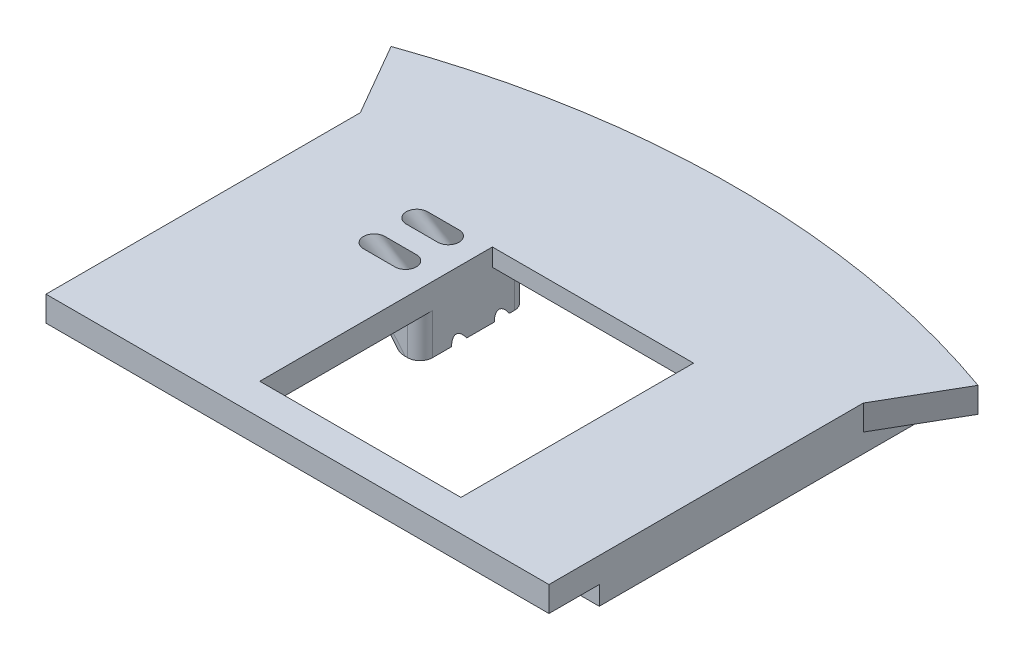
from build123d import *

# Parameters (mm, degrees)
BOSS_EXTRUDE1_DEPTH = 4
CUT_EXTRUDE1_REACH  = 149.251
SKETCH2_W           = 32
SKETCH2_H           = 37
SKETCH3_W           = 32
SKETCH3_H           = 44
CUT_EXTRUDE2_DEPTH  = 1.2
BOSS_EXTRUDE2_DEPTH = 3
CUT_EXTRUDE3_REACH  = 149.251
SKETCH5_W           = 80
SKETCH5_H           = 2
SKETCH13_W          = 10
SKETCH13_H          = 17
BOSS_EXTRUDE3_DEPTH = 6.5
LPATTERN1_COUNT     = 2
LPATTERN1_PITCH     = 6.8
CHAMFER1_SIZE       = 6
CHAMFER1_SIZE2      = 5.034597787
FILLET1_R           = 2


with BuildPart() as part:
    # Sketch1 → Boss-Extrude1 (new body)
    with BuildSketch(Plane(origin=(0, 0, 0), x_dir=(1, 0, 0), z_dir=(0, 1, 0))):
        with BuildLine():
            Line((-40, 68), (-40, 120))
            Line((-40, 120), (-46.677171015, 131.565199449))
            ThreePointArc((-46.677171015, 131.565199449), (0, 139.6), (46.677171015, 131.565199449))
            Line((46.677171015, 131.565199449), (40, 120))
            Line((40, 120), (40, 68))
            Line((40, 68), (-40, 68))
        make_face()
    extrude(amount=BOSS_EXTRUDE1_DEPTH)

    # Sketch2 → Cut-Extrude1 (cut, up to next)
    with BuildSketch(Plane(origin=(0, 4, 0), x_dir=(1, 0, 0), z_dir=(0, 1, 0)), mode=Mode.PRIVATE) as cut_extrude1_sk1:
        with Locations((5, 93.5)):
            Rectangle(SKETCH2_W, SKETCH2_H)
    cut_extrude1_tool1 = extrude(cut_extrude1_sk1.sketch, amount=-CUT_EXTRUDE1_REACH, mode=Mode.PRIVATE) & part.part
    add(cut_extrude1_tool1.solids().sort_by_distance((5, 4, -93.5))[0], mode=Mode.SUBTRACT)

    # Sketch3 → Cut-Extrude2 (cut)
    with BuildSketch(Plane.XZ):
        with Locations((5, -93.5)):
            Rectangle(SKETCH3_W, SKETCH3_H)
    extrude(amount=-CUT_EXTRUDE2_DEPTH, mode=Mode.SUBTRACT)

    # Sketch4 → Boss-Extrude2 (add)
    with BuildSketch(Plane.XZ):
        with BuildLine():
            Line((-40, -78), (-40, -130.236102159))
            ThreePointArc((-40, -130.236102159), (0, -136.240384268), (40, -130.236102159))
            Line((40, -130.236102159), (40, -78))
            Line((40, -78), (37, -78))
            Line((37, -78), (37, -128))
            ThreePointArc((37, -128), (0, -133.240384268), (-37, -128))
            Line((-37, -128), (-37, -78))
            Line((-37, -78), (-40, -78))
        make_face()
    extrude(amount=BOSS_EXTRUDE2_DEPTH)

    # Sketch5 → Cut-Extrude3 (cut, up to next)
    with BuildSketch(Plane.XZ, mode=Mode.PRIVATE) as cut_extrude3_sk1:
        with Locations((0, -69)):
            Rectangle(SKETCH5_W, SKETCH5_H)
    cut_extrude3_tool1 = extrude(cut_extrude3_sk1.sketch, amount=-CUT_EXTRUDE3_REACH, mode=Mode.PRIVATE) & part.part
    add(cut_extrude3_tool1.solids().sort_by_distance((0, 0, -69))[0], mode=Mode.SUBTRACT)

    # Sketch13 → Boss-Extrude3 (add)
    with BuildSketch(Plane.XZ):
        with Locations((-16, -109)):
            Rectangle(SKETCH13_W, SKETCH13_H)
    extrude(amount=BOSS_EXTRUDE3_DEPTH)

    # Cut-Loft1: read off the stored shape, not the designer's step
    # Cut-Loft1: loft between two sections, ruled curve by curve
    cut_loft1_from = [
        Edge.make_bspline([(-18.5, 4, -108.3), (-19.001373519, 4, -108.3), (-20.004120556, 4, -108.3), (-20.723714816, 4, -108.3), (-21.292720218, 4, -108.3), (-21.789967148, 4, -108.441885809), (-22.316617117, 4, -108.86202161), (-22.630245954, 4, -109.404072839), (-22.73490999, 4, -110), (-22.630245954, 4, -110.595927161), (-22.316617117, 4, -111.13797839), (-21.789967148, 4, -111.558114191), (-21.292720218, 4, -111.7), (-20.723714816, 4, -111.7), (-20.004120556, 4, -111.7), (-18.5, 4, -111.7), (-16.995879444, 4, -111.7), (-16.276285184, 4, -111.7), (-15.707279782, 4, -111.7), (-15.210032852, 4, -111.558114191), (-14.683382883, 4, -111.13797839), (-14.369754046, 4, -110.595927161), (-14.26509001, 4, -110), (-14.369754046, 4, -109.404072839), (-14.683382883, 4, -108.86202161), (-15.210032852, 4, -108.441885809), (-15.707279782, 4, -108.3), (-16.276285184, 4, -108.3), (-16.995879444, 4, -108.3), (-17.998626481, 4, -108.3), (-18.5, 4, -108.3)], [0.419845373, 0.419845373, 0.419845373, 0.419845373, 0.459922687, 0.5, 0.5, 0.542461343, 0.584922687, 0.62738403, 0.669845373, 0.712306716, 0.75476806, 0.797229403, 0.839690746, 0.839690746, 0.87976806, 0.919845373, 0.959922687, 1, 1, 1.042461343, 1.084922687, 1.12738403, 1.169845373, 1.212306716, 1.25476806, 1.297229403, 1.339690746, 1.339690746, 1.37976806, 1.419845373, 1.419845373, 1.419845373, 1.419845373], 3),
    ]
    cut_loft1_to = [
        Edge.make_bspline([(-12.7, -6.5, -111.8), (-12.771947826, -6.5, -111.8), (-12.915843478, -6.5, -111.8), (-13.030587652, -6.5, -111.8), (-13.379489971, -6.5, -111.8), (-13.760605324, -6.5, -111.856871893), (-14.332360426, -6.5, -112.171543481), (-14.782964502, -6.5, -112.74231317), (-14.958930975, -6.5, -113.5), (-14.782964502, -6.5, -114.25768683), (-14.332360426, -6.5, -114.828456519), (-13.760605324, -6.5, -115.143128107), (-13.379489971, -6.5, -115.2), (-13.030587652, -6.5, -115.2), (-12.915843478, -6.5, -115.2), (-12.7, -6.5, -115.2), (-12.484156522, -6.5, -115.2), (-12.369412348, -6.5, -115.2), (-12.020510029, -6.5, -115.2), (-11.639394676, -6.5, -115.143128107), (-11.067639574, -6.5, -114.828456519), (-10.617035498, -6.5, -114.25768683), (-10.441069025, -6.5, -113.5), (-10.617035498, -6.5, -112.74231317), (-11.067639574, -6.5, -112.171543481), (-11.639394676, -6.5, -111.856871893), (-12.020510029, -6.5, -111.8), (-12.369412348, -6.5, -111.8), (-12.484156522, -6.5, -111.8), (-12.628052174, -6.5, -111.8), (-12.7, -6.5, -111.8)], [0.419845373, 0.419845373, 0.419845373, 0.419845373, 0.459922687, 0.5, 0.5, 0.542461343, 0.584922687, 0.62738403, 0.669845373, 0.712306716, 0.75476806, 0.797229403, 0.839690746, 0.839690746, 0.87976806, 0.919845373, 0.959922687, 1, 1, 1.042461343, 1.084922687, 1.12738403, 1.169845373, 1.212306716, 1.25476806, 1.297229403, 1.339690746, 1.339690746, 1.37976806, 1.419845373, 1.419845373, 1.419845373, 1.419845373], 3),
    ]
    cut_loft1 = Solid(Shell([*[Face.make_surface_from_curves(cut_loft1_from[k], cut_loft1_to[k]) for k in range(1)], Face(Wire(cut_loft1_from)), Face(Wire(cut_loft1_to))]))
    add(cut_loft1, mode=Mode.SUBTRACT)

    # LPattern1: Cut-Loft1 ×2
    with Locations(*[(0, 0, i * LPATTERN1_PITCH) for i in range(1, LPATTERN1_COUNT)]):
        add(cut_loft1, mode=Mode.SUBTRACT)

    # Chamfer1
    chamfer1_edges = [part.edges().sort_by_distance(p)[0] for p in [
        (-21, -6.5, -109),
    ]]
    chamfer1_side = [part.faces().sort_by_distance(p)[0] for p in [
        (-21, -3.25, -109),
    ]]
    chamfer(chamfer1_edges, length=CHAMFER1_SIZE, length2=CHAMFER1_SIZE2, reference=chamfer1_side[0])

    # Fillet1
    fillet1_edges = [part.edges().sort_by_distance(p)[0] for p in [
        (-18.482701106, -3.5, -100.5),
        (-18.482701106, -3.5, -117.5),
        (-11, -3.25, -117.5),
        (-11, -3.25, -100.5),
    ]]
    fillet(fillet1_edges, radius=FILLET1_R)


solid = part.part
